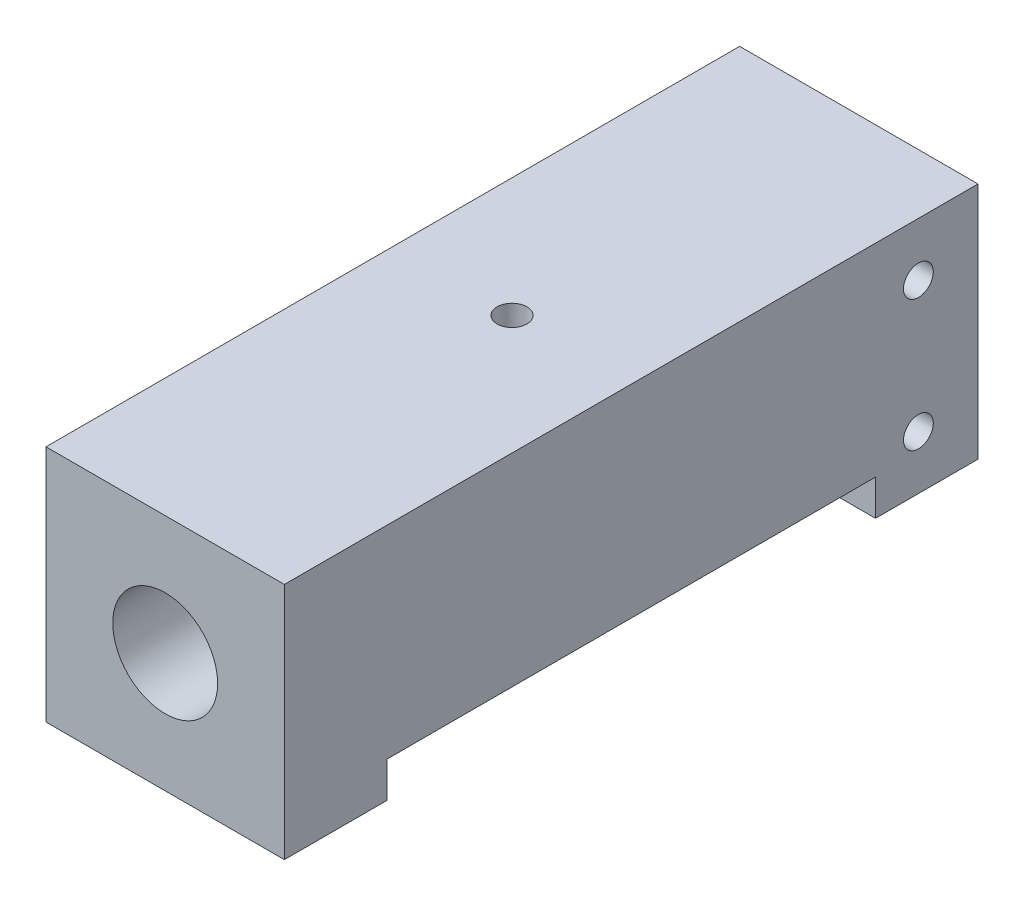
from build123d import *

# Parameters (mm, degrees)
SCHIZZO1_W                   = 20
SCHIZZO1_H                   = 20
ESTRUSIONE_ESTRUSIONE1_DEPTH = 58.2
SCHIZZO2_R                   = 3
TAGLIO_ESTRUSIONE1_DEPTH     = 60.893572276
FORO_FILETTATO_G1_8_1_D      = 8.8
FORO_FILETTATO_G1_8_1_DEPTH  = 10
FORO_FILETTATO_G1_8_1_TIP    = 2.643786724
M3_TAPPED_HOLE2_D            = 2.5
M3_TAPPED_HOLE2_DEPTH        = 5
M3_TAPPED_HOLE2_TIP          = 0.751075774
FORO_FILETTATO_M3_2_D        = 2.5
SKETCH1_W                    = 36.2
SKETCH1_H                    = 6
BOSS_EXTRUDE1_DEPTH          = 4.9
CUT_EXTRUDE1_DEPTH           = 65.087830449


with BuildPart() as part:
    # Schizzo1 → Estrusione-Estrusione1 (new body)
    with BuildSketch(Plane.XY):
        Rectangle(SCHIZZO1_W, SCHIZZO1_H)
    extrude(amount=-ESTRUSIONE_ESTRUSIONE1_DEPTH)

    # Schizzo2 → Taglio-Estrusione1 (cut, through all)
    with BuildSketch(Plane(origin=(0, 0, -58.2), x_dir=(-1, 0, 0), z_dir=(0, 0, -1))):
        Circle(SCHIZZO2_R)
    extrude(amount=-TAGLIO_ESTRUSIONE1_DEPTH, mode=Mode.SUBTRACT)

    # Foro filettato G1/8-1
    with Locations(Plane.XY):
        with Locations((0, 0)):
            Hole(FORO_FILETTATO_G1_8_1_D / 2, depth=FORO_FILETTATO_G1_8_1_DEPTH)
            with Locations((0, 0, -(FORO_FILETTATO_G1_8_1_DEPTH + FORO_FILETTATO_G1_8_1_TIP / 2))):  # 118° drill point
                Cone(0, FORO_FILETTATO_G1_8_1_D / 2, FORO_FILETTATO_G1_8_1_TIP, mode=Mode.SUBTRACT)

    # M3 Tapped Hole2
    with Locations(Plane(origin=(0, 10, -29.1), x_dir=(1, 0, 0), z_dir=(0, 1, 0))):
        with Locations((0, 0)):
            Hole(M3_TAPPED_HOLE2_D / 2, depth=M3_TAPPED_HOLE2_DEPTH)
            with Locations((0, 0, -(M3_TAPPED_HOLE2_DEPTH + M3_TAPPED_HOLE2_TIP / 2))):  # 118° drill point
                Cone(0, M3_TAPPED_HOLE2_D / 2, M3_TAPPED_HOLE2_TIP, mode=Mode.SUBTRACT)

    # Schizzo14 → Foro Ø16.0 (16)-1 (revolve, cut)
    with BuildSketch(Plane(origin=(0, 0, -58.2), x_dir=(0, 1, 0), z_dir=(1, 0, 0))):
        Polygon((0, 0), (0, 16.806884952), (8, 12), (8, 0), align=None)
    revolve(axis=Axis((0, 0, -64.55), (0, 0, 1)), mode=Mode.SUBTRACT)

    # Foro filettato M3-2 (through all)
    with Locations(Plane(origin=(10, 5.5, -53.2), x_dir=(0, 0, 1), z_dir=(1, 0, 0))):
        with Locations((0, 0), (0, 11)):
            Hole(FORO_FILETTATO_M3_2_D / 2)

    # Sketch1 → Boss-Extrude1 (add)
    with BuildSketch(Plane.ZY.offset(10)):
        with Locations((-40.1, 0)):
            Rectangle(SKETCH1_W, SKETCH1_H)
    extrude(amount=BOSS_EXTRUDE1_DEPTH)

    # Sketch2 → Cut-Extrude1 (cut, through all)
    with BuildSketch(Plane(origin=(10, 0, 0), x_dir=(0, 0, -1), z_dir=(1, 0, 0))):
        Polygon((49.6, -10), (33.6, -10), (8.6, -10), (8.6, -7), (33.6, -7), (49.6, -7), align=None)
    extrude(amount=-CUT_EXTRUDE1_DEPTH, mode=Mode.SUBTRACT)


solid = part.part
